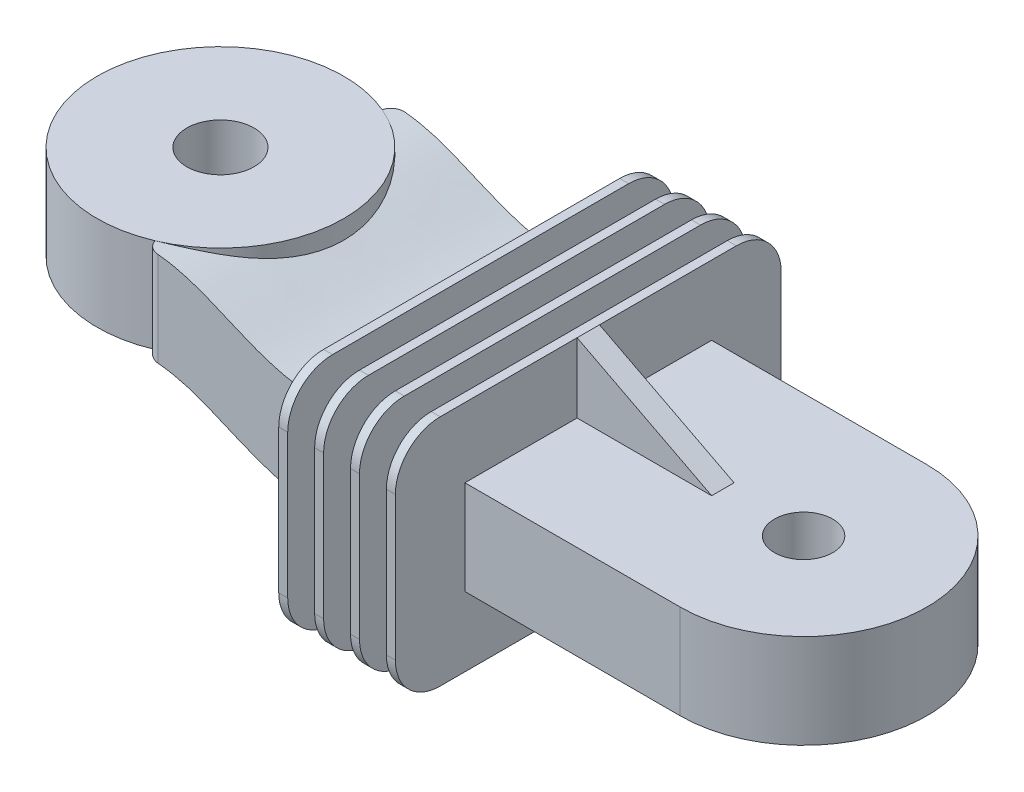
from build123d import *

# Parameters (mm, degrees)
SKETCH1_R           = 6.5
BOSS_EXTRUDE1_DEPTH = 21
BOSS_EXTRUDE2_START = -50
SKETCH3_W           = 55
SKETCH3_H           = 21
BOSS_EXTRUDE2_DEPTH = 2
LPATTERN1_COUNT     = 4
LPATTERN1_PITCH     = 8
SKETCH4_R           = 27.5
SKETCH4_R_2         = 7.5
BOSS_EXTRUDE3_DEPTH = 21
SWEEP1_START        = -27.5
SWEEP1_DEPTH        = 55
FILLET1_R           = 3
CUT_EXTRUDE1_START  = 21
CUT_EXTRUDE1_DEPTH  = 21
RIB4_REACH          = 169.295
SKETCH9_WALL_W      = 370.356888496
SKETCH9_WALL_H      = 5


# Read off the part's stored shape, not the designer's step: Sweep1
with BuildPart() as part:
    # Sketch1 → Boss-Extrude1 (new body)
    with BuildSketch(Plane(origin=(0, 0, 0), x_dir=(1, 0, 0), z_dir=(0, 1, 0))):
        with BuildLine():
            Line((0, 27.5), (-80, 27.5))
            Line((-80, 27.5), (-80, -27.5))
            Line((-80, -27.5), (0, -27.5))
            ThreePointArc((0, -27.5), (27.5, 0), (0, 27.5))
        make_face()
        with Locations(Location((0, 0, 0), (0, 0, 90))):
            Circle(SKETCH1_R, mode=Mode.SUBTRACT)
    extrude(amount=BOSS_EXTRUDE1_DEPTH)


with BuildPart() as body_2:
    # Sketch3 → Boss-Extrude2 (new body)
    with BuildSketch(Plane(origin=(0, 0, 0), x_dir=(0, 0, -1), z_dir=(1, 0, 0)).offset(BOSS_EXTRUDE2_START)):
        with BuildLine():
            Line((-33, -15.5), (33, -15.5))
            ThreePointArc((33, -15.5), (40.071067812, -12.571067812), (43, -5.5))
            Line((43, -5.5), (43, 26.5))
            ThreePointArc((43, 26.5), (40.071067812, 33.571067812), (33, 36.5))
            Line((33, 36.5), (-33, 36.5))
            ThreePointArc((-33, 36.5), (-40.071067812, 33.571067812), (-43, 26.5))
            Line((-43, 26.5), (-43, -5.5))
            ThreePointArc((-43, -5.5), (-40.071067812, -12.571067812), (-33, -15.5))
        make_face()
        with Locations((0, 10.5)):
            Rectangle(SKETCH3_W, SKETCH3_H, mode=Mode.SUBTRACT)
    boss_extrude2 = extrude(amount=BOSS_EXTRUDE2_DEPTH)


with BuildPart() as part_1:
    add(part.part)

    # LPattern1: Boss-Extrude2 ×4
    with Locations(*[(-i * LPATTERN1_PITCH, 0, 0) for i in range(1, LPATTERN1_COUNT)]):
        add(boss_extrude2)



with BuildPart() as body_3:
    # Sketch4 → Boss-Extrude3 (new body)
    with BuildSketch(Plane(origin=(0, 10, 0), x_dir=(1, 0, 0), z_dir=(0, 1, 0))):
        with Locations(Location((-130, 0, 0), (0, 0, 90))):
            Circle(SKETCH4_R)
        with Locations(Location((-130, 0, 0), (0, 0, 90))):
            Circle(SKETCH4_R_2, mode=Mode.SUBTRACT)
    extrude(amount=BOSS_EXTRUDE3_DEPTH)


with BuildPart() as part_2:
    add(part_1.part)

    add(body_3.part)  # Sweep1 merges body 3
    # Sweep1 outline → Sweep1 (add)
    with BuildSketch(Plane.XY.offset(SWEEP1_START)):
        with BuildLine():
            Line((-80, 0), (-80, 21))
            add(Edge.make_bspline(
                [(-80, 21), (-86.827647421, 20.344373746), (-93.439203359, 22.931124684), (-105.876424342, 28.26148667), (-111.667729409, 30.999999996), (-119.254055637, 31)],
                knots=[0, 0, 0, 0, 0.5, 0.5, 1, 1, 1, 1], degree=3))
            Line((-119.254055637, 31), (-119.254055637, 10))
            add(Edge.make_bspline(
                [(-80, 0), (-86.827647421, -0.655626254), (-93.439203359, 1.931124684), (-105.876424342, 7.26148667), (-111.667729409, 9.999999996), (-119.254055637, 10)],
                knots=[0, 0, 0, 0, 0.5, 0.5, 1, 1, 1, 1], degree=3))
        make_face()
    extrude(amount=SWEEP1_DEPTH)

    # Fillet1
    # the kernel refuses this fillet: 3 mm, written as the material it takes off along each edge
    with BuildSketch(Plane(origin=(-119.254055637, 38.218973628, -27.5), x_dir=(0, 0, 1), z_dir=(0, -1, 0))) as fillet1_piece_1_section:
        with BuildLine():
            CenterArc((3, -2.887589451), FILLET1_R, 105.734249822, 74.265750178)
            Line((0, -2.887589451), (-0.06, -2.887589451))
            Line((-0.06, -2.887589451), (-0.06, 0))
            Line((-0.06, 0), (0, 0.06))
            ThreePointArc((0, 0.06), (1.093236198, 0.06), (2.170201844, 0.057751789))
            Line((2.170201844, 0.057751789), (2.186472396, 0))
        make_face()
    fillet1_piece_1 = extrude(amount=35.437947255, mode=Mode.PRIVATE)
    fillet1_piece_1 = fillet1_piece_1 - Plane(origin=(-130, 20.5, 0), x_dir=(0, 0, -1), z_dir=(0, -1, 0)) * Cylinder(27.5, 83, mode=Mode.PRIVATE)
    add(fillet1_piece_1, mode=Mode.SUBTRACT)
    with BuildSketch(Plane(origin=(-119.254055637, 38.218973628, 27.5), x_dir=(0, 0, -1), z_dir=(0, -1, 0))) as fillet1_piece_2_section:
        with BuildLine():
            CenterArc((3, 2.887589451), FILLET1_R, 180, 74.265750178)
            Line((0, 2.887589451), (-0.06, 2.887589451))
            Line((-0.06, 2.887589451), (-0.06, 0))
            Line((-0.06, 0), (0, -0.06))
            ThreePointArc((0, -0.06), (1.093236198, -0.06), (2.170201844, -0.057751789))
            Line((2.170201844, -0.057751789), (2.186472396, 0))
        make_face()
    fillet1_piece_2 = extrude(amount=35.437947255, mode=Mode.PRIVATE)
    fillet1_piece_2 = fillet1_piece_2 - Plane(origin=(-130, 20.5, 0), x_dir=(0, 0, -1), z_dir=(0, -1, 0)) * Cylinder(27.5, 83, mode=Mode.PRIVATE)
    add(fillet1_piece_2, mode=Mode.SUBTRACT)

    # Sketch7 → Cut-Extrude1 (cut)
    with BuildSketch(Plane.XZ.offset(-10).offset(CUT_EXTRUDE1_START)):
        with BuildLine():
            ThreePointArc((-119.254055637, 25.313527604), (-157.5, 0), (-119.254055637, -25.313527604))
            ThreePointArc((-119.254055637, -25.313527604), (-102.5, 0), (-119.254055637, 25.313527604))
        make_face()
    extrude(amount=-CUT_EXTRUDE1_DEPTH, mode=Mode.SUBTRACT)


with BuildPart() as body_2_1:
    add(body_2.part)

    # Combine1: union part
    add(part_2.part)

    # Sketch9 wall → Rib4 (add, up to next)
    with BuildSketch(Plane(origin=(-33, 28.75, 0), x_dir=(0.888425906857, -0.459020051876, 0), z_dir=(0.459020051876, 0.888425906857, 0)), mode=Mode.PRIVATE) as rib4_sk1:
        Rectangle(SKETCH9_WALL_W, SKETCH9_WALL_H)
    rib4_tool1 = extrude(rib4_sk1.sketch, amount=-RIB4_REACH, mode=Mode.PRIVATE) - body_2_1.part
    add(rib4_tool1.solids().sort_by_distance((-33, 28.75, 0))[0])


solid = body_2_1.part
